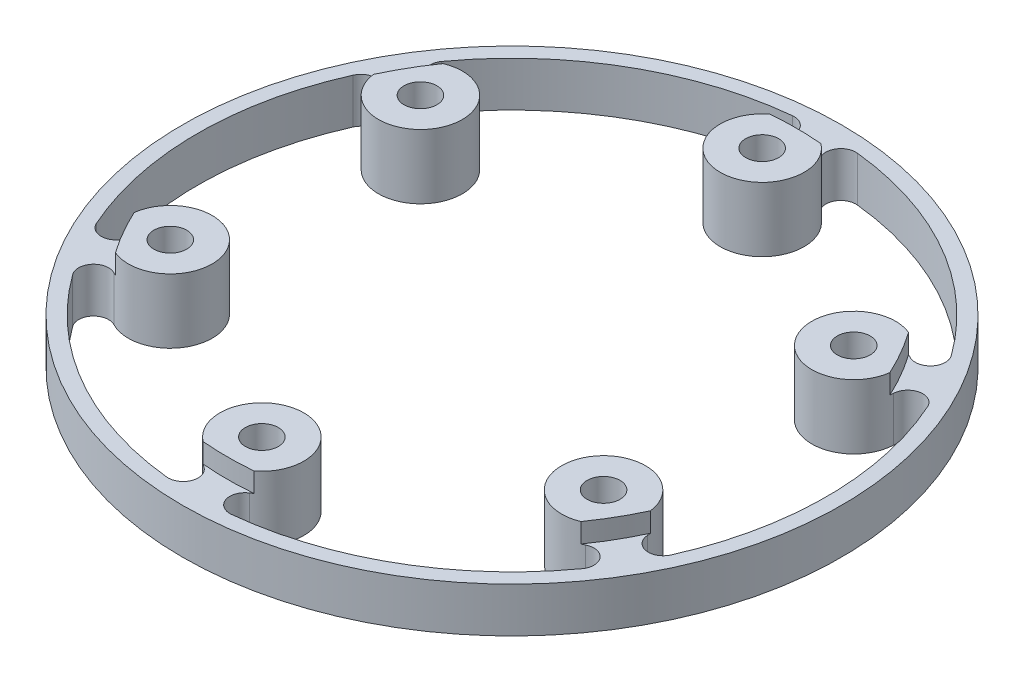
from build123d import *

# Parameters (mm, degrees)
SKETCH1_R             = 22
BASE_SHAPE_DEPTH      = 4.3
BASE_CUT_REACH        = 33.408
SKETCH4_R             = 2.1
MILLING_FILLETS_R     = 1
MIDDLE_START          = -1.3
SKETCH5_R             = 22
SKETCH5_R_2           = 19
MIDDLE_SLOT_CUT_DEPTH = 1.3
M2_SCREW_HOLES_REACH  = 33.408
SKETCH6_R             = 1.1
REMOVE_INNER_REACH    = 33.408


with BuildPart() as part:
    # Sketch1 → Base shape (new body)
    with BuildSketch(Plane(origin=(0, 0, 0), x_dir=(1, 0, 0), z_dir=(0, 1, 0))):
        Circle(SKETCH1_R)
    extrude(amount=BASE_SHAPE_DEPTH)

    # Sketch4 → Base cut (cut, up to next)
    with BuildSketch(Plane(origin=(0, 4.3, 0), x_dir=(1, 0, 0), z_dir=(0, 1, 0)), mode=Mode.PRIVATE) as base_cut_sk1:
        with BuildLine():
            Line((-0.5, 4.623040125), (-0.5, 13.945004537))
            ThreePointArc((-0.5, 13.945004537), (-2.746076212, 16.153131244), (-1.517286534, 19.053261901))
            ThreePointArc((-1.517286534, 19.053261901), (-1.115725557, 20.225230181), (-2.162133235, 20.888398212))
            ThreePointArc((-2.162133235, 20.888398212), (-10.500000003, 18.186533478), (-17.008816883, 12.316661408))
            ThreePointArc((-17.008816883, 12.316661408), (-16.957700355, 11.078861766), (-15.74196557, 10.84063963))
            ThreePointArc((-15.74196557, 10.84063963), (-12.615983904, 10.454737385), (-11.826728185, 7.40551497))
            Line((-11.826728185, 7.40551497), (-3.753670191, 2.744532765))
            ThreePointArc((-3.753670191, 2.744532765), (-2.325, 4.027018128), (-0.5, 4.623040125))
        make_face()
    base_cut_tool1 = extrude(base_cut_sk1.sketch, amount=-BASE_CUT_REACH, mode=Mode.PRIVATE) & part.part
    # Sketch4 → Base cut (cut, up to next)
    with BuildSketch(Plane(origin=(0, 4.3, 0), x_dir=(1, 0, 0), z_dir=(0, 1, 0)), mode=Mode.PRIVATE) as base_cut_sk2:
        with BuildLine():
            Line((0.5, 13.945004537), (0.5, 4.623040125))
            ThreePointArc((0.5, 4.623040125), (2.325, 4.027018128), (3.753670191, 2.744532765))
            Line((3.753670191, 2.744532765), (11.826728185, 7.40551497))
            ThreePointArc((11.826728185, 7.40551497), (12.615983941, 10.454737417), (15.741965657, 10.840639586))
            ThreePointArc((15.741965657, 10.840639586), (16.957700372, 11.078861786), (17.00881691, 12.316661371))
            ThreePointArc((17.00881691, 12.316661371), (10.500000058, 18.186533446), (2.162133314, 20.888398204))
            ThreePointArc((2.162133314, 20.888398204), (1.11572557, 20.225230219), (1.517286532, 19.053261902))
            ThreePointArc((1.517286532, 19.053261902), (2.746076212, 16.153131245), (0.5, 13.945004537))
        make_face()
    base_cut_tool2 = extrude(base_cut_sk2.sketch, amount=-BASE_CUT_REACH, mode=Mode.PRIVATE) & part.part
    # Sketch4 → Base cut (cut, up to next)
    with BuildSketch(Plane(origin=(0, 4.3, 0), x_dir=(1, 0, 0), z_dir=(0, 1, 0)), mode=Mode.PRIVATE) as base_cut_sk3:
        with BuildLine():
            ThreePointArc((-4.253670191, -1.878507361), (-4.65, 0), (-4.253670191, 1.878507361))
            Line((-4.253670191, 1.878507361), (-12.326728185, 6.539489567))
            ThreePointArc((-12.326728185, 6.539489567), (-15.362060141, 5.698393871), (-17.259252101, 8.212622326))
            ThreePointArc((-17.259252101, 8.212622326), (-18.073426017, 9.146368434), (-19.170950177, 8.571736657))
            ThreePointArc((-19.170950177, 8.571736657), (-21, -2.3e-08), (-19.170950158, -8.571736698))
            ThreePointArc((-19.170950158, -8.571736698), (-18.073425944, -9.146368421), (-17.259252096, -8.212622223))
            ThreePointArc((-17.259252096, -8.212622223), (-15.362060093, -5.698393854), (-12.326728185, -6.539489567))
            Line((-12.326728185, -6.539489567), (-4.253670191, -1.878507361))
        make_face()
    base_cut_tool3 = extrude(base_cut_sk3.sketch, amount=-BASE_CUT_REACH, mode=Mode.PRIVATE) & part.part
    # Sketch4 → Base cut (cut, up to next)
    with BuildSketch(Plane(origin=(0, 4.3, 0), x_dir=(1, 0, 0), z_dir=(0, 1, 0)), mode=Mode.PRIVATE) as base_cut_sk4:
        with BuildLine():
            Line((12.326728185, 6.539489567), (4.253670191, 1.878507361))
            ThreePointArc((4.253670191, 1.878507361), (4.65, 0), (4.253670191, -1.878507361))
            Line((4.253670191, -1.878507361), (12.326728185, -6.539489567))
            ThreePointArc((12.326728185, -6.539489567), (15.362060141, -5.698393871), (17.259252101, -8.212622326))
            ThreePointArc((17.259252101, -8.212622326), (18.07342595, -9.146368422), (19.170950121, -8.571736781))
            ThreePointArc((19.170950121, -8.571736781), (21, -9e-09), (19.170950128, 8.571736765))
            ThreePointArc((19.170950128, 8.571736765), (18.073425908, 9.146368414), (17.259252096, 8.212622223))
            ThreePointArc((17.259252096, 8.212622223), (15.362060093, 5.698393854), (12.326728185, 6.539489567))
        make_face()
    base_cut_tool4 = extrude(base_cut_sk4.sketch, amount=-BASE_CUT_REACH, mode=Mode.PRIVATE) & part.part
    # Sketch4 → Base cut (cut, up to next)
    with BuildSketch(Plane(origin=(0, 4.3, 0), x_dir=(1, 0, 0), z_dir=(0, 1, 0)), mode=Mode.PRIVATE) as base_cut_sk5:
        with BuildLine():
            ThreePointArc((-0.5, -4.623040125), (-2.325, -4.027018128), (-3.753670191, -2.744532765))
            Line((-3.753670191, -2.744532765), (-11.826728185, -7.40551497))
            ThreePointArc((-11.826728185, -7.40551497), (-12.615983918, -10.454737397), (-15.741965602, -10.840639614))
            ThreePointArc((-15.741965602, -10.840639614), (-16.957700382, -11.078861797), (-17.008816856, -12.316661445))
            ThreePointArc((-17.008816856, -12.316661445), (-10.500000018, -18.186533469), (-2.162133314, -20.888398204))
            ThreePointArc((-2.162133314, -20.888398204), (-1.115725572, -20.225230224), (-1.517286523, -19.053261908))
            ThreePointArc((-1.517286523, -19.053261908), (-2.746076213, -16.15313125), (-0.5, -13.945004537))
            Line((-0.5, -13.945004537), (-0.5, -4.623040125))
        make_face()
    base_cut_tool5 = extrude(base_cut_sk5.sketch, amount=-BASE_CUT_REACH, mode=Mode.PRIVATE) & part.part
    # Sketch4 → Base cut (cut, up to next)
    with BuildSketch(Plane(origin=(0, 4.3, 0), x_dir=(1, 0, 0), z_dir=(0, 1, 0)), mode=Mode.PRIVATE) as base_cut_sk6:
        with BuildLine():
            Line((11.826728185, -7.40551497), (3.753670191, -2.744532765))
            ThreePointArc((3.753670191, -2.744532765), (2.325, -4.027018128), (0.5, -4.623040125))
            Line((0.5, -4.623040125), (0.5, -13.945004537))
            ThreePointArc((0.5, -13.945004537), (2.746076211, -16.15313124), (1.51728654, -19.053261897))
            ThreePointArc((1.51728654, -19.053261897), (1.115725569, -20.225230215), (2.162133314, -20.888398204))
            ThreePointArc((2.162133314, -20.888398204), (10.499999986, -18.186533488), (17.008816813, -12.316661505))
            ThreePointArc((17.008816813, -12.316661505), (16.957700403, -11.078861822), (15.741965594, -10.840639618))
            ThreePointArc((15.741965594, -10.840639618), (12.615983914, -10.454737394), (11.826728185, -7.40551497))
        make_face()
    base_cut_tool6 = extrude(base_cut_sk6.sketch, amount=-BASE_CUT_REACH, mode=Mode.PRIVATE) & part.part
    # Sketch4 → Base cut (cut, up to next)
    with BuildSketch(Plane(origin=(0, 4.3, 0), x_dir=(1, 0, 0), z_dir=(0, 1, 0)), mode=Mode.PRIVATE) as base_cut_sk7:
        Circle(SKETCH4_R)
    base_cut_tool7 = extrude(base_cut_sk7.sketch, amount=-BASE_CUT_REACH, mode=Mode.PRIVATE) & part.part
    add(base_cut_tool1.solids().sort_by_distance((-6.978507, 4.3, -12.087128))[0], mode=Mode.SUBTRACT)
    add(base_cut_tool2.solids().sort_by_distance((6.978507, 4.3, -12.087128))[0], mode=Mode.SUBTRACT)
    add(base_cut_tool3.solids().sort_by_distance((-13.957013, 4.3, 0))[0], mode=Mode.SUBTRACT)
    add(base_cut_tool4.solids().sort_by_distance((13.957013, 4.3, 0))[0], mode=Mode.SUBTRACT)
    add(base_cut_tool5.solids().sort_by_distance((-6.978507, 4.3, 12.087128))[0], mode=Mode.SUBTRACT)
    add(base_cut_tool6.solids().sort_by_distance((6.978507, 4.3, 12.087128))[0], mode=Mode.SUBTRACT)
    add(base_cut_tool7.solids().sort_by_distance((0, 4.3, 0))[0], mode=Mode.SUBTRACT)

    # Milling fillets
    milling_fillets_edges = [part.edges().sort_by_distance(p)[0] for p in [
        (11.826728185, 2.15, 7.40551497),
        (0.5, 2.15, 4.623040125),
        (12.326728185, 2.15, -6.539489567),
        (-0.5, 2.15, -4.623040125),
        (11.826728185, 2.15, -7.40551497),
        (0.5, 2.15, -4.623040125),
        (4.253670191, 2.15, 1.878507361),
        (0.5, 2.15, -13.945004537),
        (-11.826728185, 2.15, 7.40551497),
        (0.5, 2.15, 13.945004537),
        (3.753670191, 2.15, 2.744532765),
        (-0.5, 2.15, 4.623040125),
        (-0.5, 2.15, -13.945004537),
        (-0.5, 2.15, 13.945004537),
        (12.326728185, 2.15, 6.539489567),
        (3.753670191, 2.15, -2.744532765),
        (-4.253670191, 2.15, 1.878507361),
        (-12.326728185, 2.15, 6.539489567),
        (-3.753670191, 2.15, -2.744532765),
        (-11.826728185, 2.15, -7.40551497),
        (-12.326728185, 2.15, -6.539489567),
        (-4.253670191, 2.15, -1.878507361),
        (4.253670191, 2.15, -1.878507361),
        (-3.753670191, 2.15, 2.744532765),
    ]]
    fillet(milling_fillets_edges, radius=MILLING_FILLETS_R)

    # Sketch5 → Middle slot cut (cut)
    with BuildSketch(Plane(origin=(0, 4.3, 0), x_dir=(1, 0, 0), z_dir=(0, 1, 0)).offset(MIDDLE_START)):
        Circle(SKETCH5_R)
        Circle(SKETCH5_R_2, mode=Mode.SUBTRACT)
    extrude(amount=MIDDLE_SLOT_CUT_DEPTH, mode=Mode.SUBTRACT)

    # Sketch6 → M2 screw holes (cut, up to next)
    with BuildSketch(Plane(origin=(0, 4.3, 0), x_dir=(1, 0, 0), z_dir=(0, 1, 0)), mode=Mode.PRIVATE) as m2_screw_holes_sk1:
        with Locations((0, 16.7)):
            Circle(SKETCH6_R)
    m2_screw_holes_tool1 = extrude(m2_screw_holes_sk1.sketch, amount=-M2_SCREW_HOLES_REACH, mode=Mode.PRIVATE) & part.part
    # Sketch6 → M2 screw holes (cut, up to next)
    with BuildSketch(Plane(origin=(0, 4.3, 0), x_dir=(1, 0, 0), z_dir=(0, 1, 0)), mode=Mode.PRIVATE) as m2_screw_holes_sk2:
        with Locations((14.462624243, 8.35)):
            Circle(SKETCH6_R)
    m2_screw_holes_tool2 = extrude(m2_screw_holes_sk2.sketch, amount=-M2_SCREW_HOLES_REACH, mode=Mode.PRIVATE) & part.part
    # Sketch6 → M2 screw holes (cut, up to next)
    with BuildSketch(Plane(origin=(0, 4.3, 0), x_dir=(1, 0, 0), z_dir=(0, 1, 0)), mode=Mode.PRIVATE) as m2_screw_holes_sk3:
        with Locations((14.462624243, -8.35)):
            Circle(SKETCH6_R)
    m2_screw_holes_tool3 = extrude(m2_screw_holes_sk3.sketch, amount=-M2_SCREW_HOLES_REACH, mode=Mode.PRIVATE) & part.part
    # Sketch6 → M2 screw holes (cut, up to next)
    with BuildSketch(Plane(origin=(0, 4.3, 0), x_dir=(1, 0, 0), z_dir=(0, 1, 0)), mode=Mode.PRIVATE) as m2_screw_holes_sk4:
        with Locations((0, -16.7)):
            Circle(SKETCH6_R)
    m2_screw_holes_tool4 = extrude(m2_screw_holes_sk4.sketch, amount=-M2_SCREW_HOLES_REACH, mode=Mode.PRIVATE) & part.part
    # Sketch6 → M2 screw holes (cut, up to next)
    with BuildSketch(Plane(origin=(0, 4.3, 0), x_dir=(1, 0, 0), z_dir=(0, 1, 0)), mode=Mode.PRIVATE) as m2_screw_holes_sk5:
        with Locations((-14.462624243, -8.35)):
            Circle(SKETCH6_R)
    m2_screw_holes_tool5 = extrude(m2_screw_holes_sk5.sketch, amount=-M2_SCREW_HOLES_REACH, mode=Mode.PRIVATE) & part.part
    # Sketch6 → M2 screw holes (cut, up to next)
    with BuildSketch(Plane(origin=(0, 4.3, 0), x_dir=(1, 0, 0), z_dir=(0, 1, 0)), mode=Mode.PRIVATE) as m2_screw_holes_sk6:
        with Locations((-14.462624243, 8.35)):
            Circle(SKETCH6_R)
    m2_screw_holes_tool6 = extrude(m2_screw_holes_sk6.sketch, amount=-M2_SCREW_HOLES_REACH, mode=Mode.PRIVATE) & part.part
    add(m2_screw_holes_tool1.solids().sort_by_distance((0, 4.3, -16.7))[0], mode=Mode.SUBTRACT)
    add(m2_screw_holes_tool2.solids().sort_by_distance((14.462624, 4.3, -8.35))[0], mode=Mode.SUBTRACT)
    add(m2_screw_holes_tool3.solids().sort_by_distance((14.462624, 4.3, 8.35))[0], mode=Mode.SUBTRACT)
    add(m2_screw_holes_tool4.solids().sort_by_distance((0, 4.3, 16.7))[0], mode=Mode.SUBTRACT)
    add(m2_screw_holes_tool5.solids().sort_by_distance((-14.462624, 4.3, 8.35))[0], mode=Mode.SUBTRACT)
    add(m2_screw_holes_tool6.solids().sort_by_distance((-14.462624, 4.3, -8.35))[0], mode=Mode.SUBTRACT)

    # Sketch9 → Remove inner (cut, up to next)
    with BuildSketch(Plane(origin=(0, 4.3, 0), x_dir=(1, 0, 0), z_dir=(0, 1, 0)), mode=Mode.PRIVATE) as remove_inner_sk1:
        with BuildLine():
            ThreePointArc((12.787298234, -6.106502114), (12.247842131, -6.303518255), (11.688967517, -6.171278273))
            Line((11.688967517, -6.171278273), (4.967454292, -2.290610804))
            ThreePointArc((4.967454292, -2.290610804), (4.544902316, -1.810458242), (4.499763267, -1.172446391))
            ThreePointArc((4.499763267, -1.172446391), (4.65, 0), (4.499763267, 1.172446391))
            ThreePointArc((4.499763267, 1.172446391), (4.544902316, 1.810458242), (4.967454292, 2.290610804))
            Line((4.967454292, 2.290610804), (11.688967517, 6.171278273))
            ThreePointArc((11.688967517, 6.171278273), (12.247842131, 6.303518255), (12.787298234, 6.106502114))
            ThreePointArc((12.787298234, 6.106502114), (12.037753113, 6.95), (11.682035076, 8.020874059))
            ThreePointArc((11.682035076, 8.020874059), (11.582928007, 7.455183299), (11.188967517, 7.037303677))
            Line((11.188967517, 7.037303677), (4.467454292, 3.156636207))
            ThreePointArc((4.467454292, 3.156636207), (3.840353988, 3.030771742), (3.265249993, 3.310686105))
            ThreePointArc((3.265249993, 3.310686105), (2.325, 4.027018128), (1.234513274, 4.483132496))
            ThreePointArc((1.234513274, 4.483132496), (0.704548328, 4.841229984), (0.5, 5.447247011))
            Line((0.5, 5.447247011), (0.5, 13.20858195))
            ThreePointArc((0.5, 13.20858195), (0.664914124, 13.758701554), (1.105263158, 14.127376174))
            ThreePointArc((1.105263158, 14.127376174), (0, 13.9), (-1.105263158, 14.127376174))
            ThreePointArc((-1.105263158, 14.127376174), (-0.664914124, 13.758701554), (-0.5, 13.20858195))
            Line((-0.5, 13.20858195), (-0.5, 5.447247011))
            ThreePointArc((-0.5, 5.447247011), (-0.704548328, 4.841229984), (-1.234513274, 4.483132496))
            ThreePointArc((-1.234513274, 4.483132496), (-2.325, 4.027018128), (-3.265249993, 3.310686105))
            ThreePointArc((-3.265249993, 3.310686105), (-3.840353988, 3.030771742), (-4.467454292, 3.156636207))
            Line((-4.467454292, 3.156636207), (-11.188967517, 7.037303677))
            ThreePointArc((-11.188967517, 7.037303677), (-11.582928007, 7.455183299), (-11.682035076, 8.020874059))
            ThreePointArc((-11.682035076, 8.020874059), (-12.037753113, 6.95), (-12.787298234, 6.106502114))
            ThreePointArc((-12.787298234, 6.106502114), (-12.247842131, 6.303518255), (-11.688967517, 6.171278273))
            Line((-11.688967517, 6.171278273), (-4.967454292, 2.290610804))
            ThreePointArc((-4.967454292, 2.290610804), (-4.544902316, 1.810458242), (-4.499763267, 1.172446391))
            ThreePointArc((-4.499763267, 1.172446391), (-4.65, 0), (-4.499763267, -1.172446391))
            ThreePointArc((-4.499763267, -1.172446391), (-4.544902316, -1.810458242), (-4.967454292, -2.290610804))
            Line((-4.967454292, -2.290610804), (-11.688967517, -6.171278273))
            ThreePointArc((-11.688967517, -6.171278273), (-12.247842131, -6.303518255), (-12.787298234, -6.106502114))
            ThreePointArc((-12.787298234, -6.106502114), (-12.037753113, -6.95), (-11.682035076, -8.020874059))
            ThreePointArc((-11.682035076, -8.020874059), (-11.582928007, -7.455183299), (-11.188967517, -7.037303677))
            Line((-11.188967517, -7.037303677), (-4.467454292, -3.156636207))
            ThreePointArc((-4.467454292, -3.156636207), (-3.840353988, -3.030771742), (-3.265249993, -3.310686105))
            ThreePointArc((-3.265249993, -3.310686105), (-2.325, -4.027018128), (-1.234513274, -4.483132496))
            ThreePointArc((-1.234513274, -4.483132496), (-0.704548328, -4.841229984), (-0.5, -5.447247011))
            Line((-0.5, -5.447247011), (-0.5, -13.20858195))
            ThreePointArc((-0.5, -13.20858195), (-0.664914124, -13.758701554), (-1.105263158, -14.127376174))
            ThreePointArc((-1.105263158, -14.127376174), (0, -13.9), (1.105263158, -14.127376174))
            ThreePointArc((1.105263158, -14.127376174), (0.664914124, -13.758701554), (0.5, -13.20858195))
            Line((0.5, -13.20858195), (0.5, -5.447247011))
            ThreePointArc((0.5, -5.447247011), (0.704548328, -4.841229984), (1.234513274, -4.483132496))
            ThreePointArc((1.234513274, -4.483132496), (2.325, -4.027018128), (3.265249993, -3.310686105))
            ThreePointArc((3.265249993, -3.310686105), (3.840353988, -3.030771742), (4.467454292, -3.156636207))
            Line((4.467454292, -3.156636207), (11.188967517, -7.037303677))
            ThreePointArc((11.188967517, -7.037303677), (11.582928007, -7.455183299), (11.682035076, -8.020874059))
            ThreePointArc((11.682035076, -8.020874059), (12.037753113, -6.95), (12.787298234, -6.106502114))
        make_face()
    remove_inner_tool1 = extrude(remove_inner_sk1.sketch, amount=-REMOVE_INNER_REACH, mode=Mode.PRIVATE) & part.part
    add(remove_inner_tool1.solids().sort_by_distance((0, 4.3, 0))[0], mode=Mode.SUBTRACT)


solid = part.part
